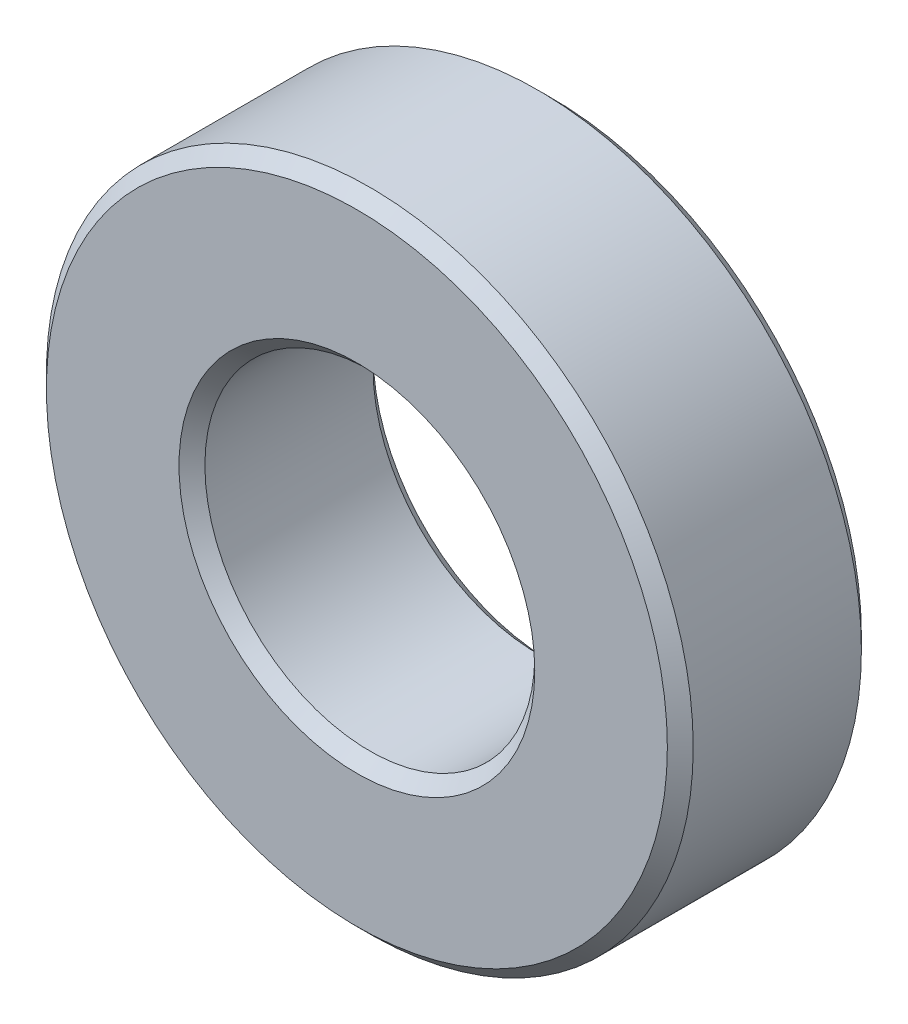
from build123d import *

# Parameters (mm, degrees)
SKETCH1_R           = 5
SKETCH1_R_2         = 2.55
BOSS_EXTRUDE1_DEPTH = 3
CHAMFER1_SIZE       = 0.2


with BuildPart() as part:
    # Sketch1 → Boss-Extrude1 (new body)
    with BuildSketch(Plane.XY):
        Circle(SKETCH1_R)
        Circle(SKETCH1_R_2, mode=Mode.SUBTRACT)
    extrude(amount=BOSS_EXTRUDE1_DEPTH)

    # Chamfer1
    chamfer1_edges = [part.edges().sort_by_distance(p)[0] for p in [
        (-5, 0, 0),
        (-2.55, 0, 0),
        (-2.55, 0, 3),
        (-5, 0, 3),
    ]]
    chamfer(chamfer1_edges, length=CHAMFER1_SIZE)


solid = part.part
